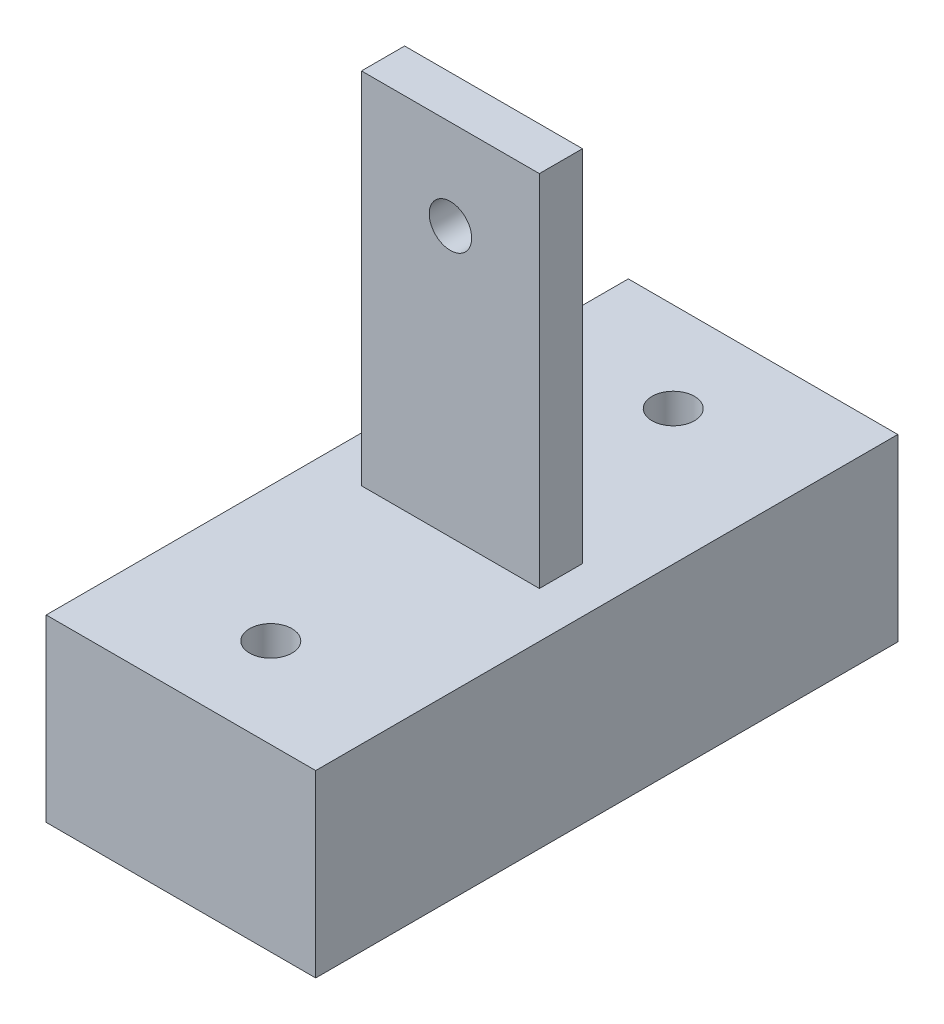
from build123d import *

# Parameters (mm, degrees)
BOSS_EXTRUDE1_DEPTH = 9.525
SKETCH1_3_W         = 3.048
SKETCH1_3_H         = 25.4
BOSS_EXTRUDE2_DEPTH = 6.2865
SKETCH2_R           = 1.5
CUT_EXTRUDE1_DEPTH  = 46.06281426
SKETCH4_R           = 1.5
CUT_EXTRUDE3_DEPTH  = 35.046660644
SKETCH5_R           = 4.7625
CUT_EXTRUDE4_DEPTH  = 6.35


with BuildPart() as part:
    # Sketch1 → Boss-Extrude1 (new, symmetric)
    with BuildSketch(Plane(origin=(0, 0, 0), x_dir=(0, 0, -1), z_dir=(1, 0, 0))):
        Polygon((-1.524, 12.7), (-20.574, 12.7), (-20.574, 0), (20.574, 0), (20.574, 12.7), (1.524, 12.7), align=None)
    extrude(amount=BOSS_EXTRUDE1_DEPTH, both=True)

    # Sketch1<3> → Boss-Extrude2 (add, symmetric)
    with BuildSketch(Plane(origin=(0, 0, 0), x_dir=(0, 0, -1), z_dir=(1, 0, 0))):
        with Locations((0, 25.4)):
            Rectangle(SKETCH1_3_W, SKETCH1_3_H)
    extrude(amount=BOSS_EXTRUDE2_DEPTH, both=True)

    # Sketch2 → Cut-Extrude1 (cut, through all)
    with BuildSketch(Plane.XY.offset(1.524)):
        with Locations((0, 31.75)):
            Circle(SKETCH2_R)
    extrude(amount=-CUT_EXTRUDE1_DEPTH, mode=Mode.SUBTRACT)

    # Sketch4 → Cut-Extrude3 (cut, through all)
    with BuildSketch(Plane(origin=(0, 12.7, 0), x_dir=(1, 0, 0), z_dir=(0, 1, 0))):
        with Locations((0, -14.224)):
            Circle(SKETCH4_R)
        with Locations((0, 14.224)):
            Circle(SKETCH4_R)
    extrude(amount=-CUT_EXTRUDE3_DEPTH, mode=Mode.SUBTRACT)

    # Sketch5 → Cut-Extrude4 (cut)
    with BuildSketch(Plane.XZ):
        with Locations((0, 14.224)):
            Circle(SKETCH5_R)
        with Locations((0, -14.224)):
            Circle(SKETCH5_R)
    extrude(amount=-CUT_EXTRUDE4_DEPTH, mode=Mode.SUBTRACT)


solid = part.part
